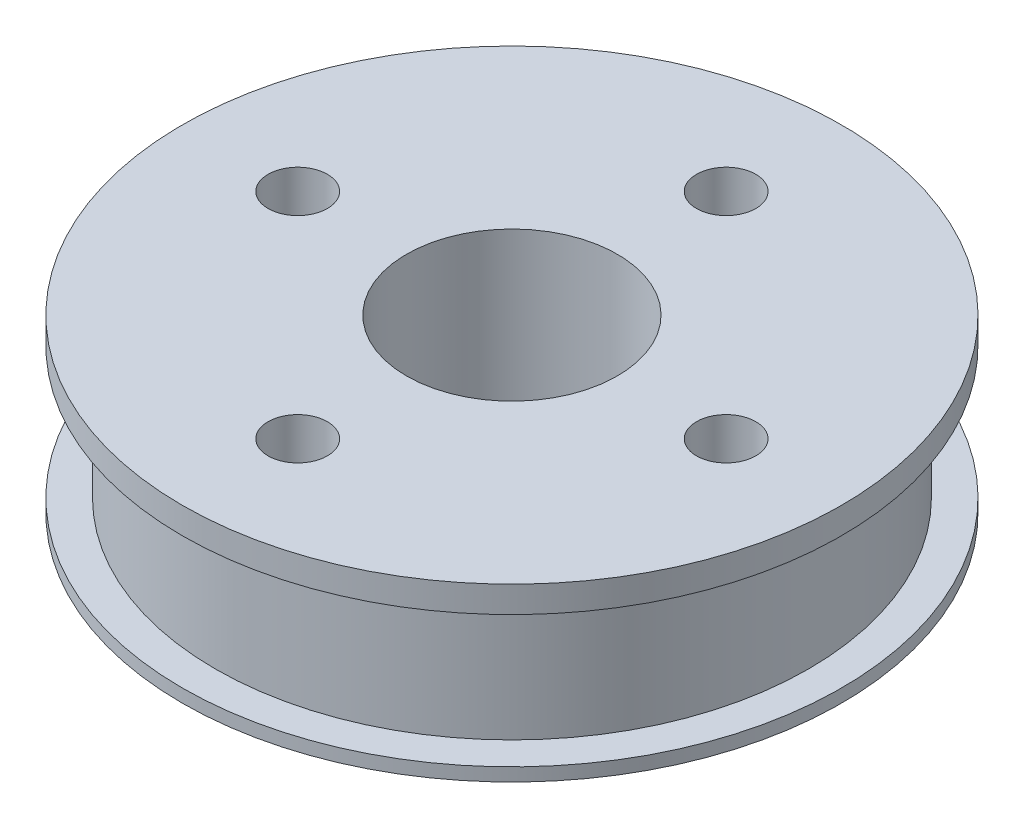
from build123d import *

# Parameters (mm, degrees)
ESCAREADO_PARA_PARAFUSO_COM_CABE_A_ESCAR_D           = 4.5
ESCAREADO_PARA_PARAFUSO_COM_CABE_A_ESCAR_DEPTH       = 30
ESCAREADO_PARA_PARAFUSO_COM_CABE_A_ESCAR_CSINK_D     = 9.4
ESCAREADO_PARA_PARAFUSO_COM_CABE_A_ESCAR_CSINK_ANGLE = 90
ESCAREADO_PARA_PARAFUSO_COM_CABE_A_ESCAR_TIP         = 1.351936393


with BuildPart() as part:
    # Sketch1 → Revolve1 (revolve)
    with BuildSketch(Plane(origin=(0, 0, 0), x_dir=(0, 0, -1), z_dir=(1, 0, 0))):
        Polygon((25, 7.798179075), (22.5, 7.798179075), (8, 7.798179075), (8, -3.962100009), (8, -5.201820925), (25, -5.201820925), (25, -4.201820925), (22.5, -4.201820925), (22.5, 5.798179075), (25, 5.798179075), align=None)
    revolve(axis=Axis((0, 5.251496666, 0), (0, -1, 0)))

    # Escareado para parafuso com cabeça escareada chata de M41
    with Locations(Plane(origin=(0, -5.201820925, 0), x_dir=(-1, 0, 0), z_dir=(0, -1, 0))):
        with Locations((0, 16.25), (-16.25, 0), (0, -16.25), (16.25, 0)):
            CounterSinkHole(ESCAREADO_PARA_PARAFUSO_COM_CABE_A_ESCAR_D / 2, ESCAREADO_PARA_PARAFUSO_COM_CABE_A_ESCAR_CSINK_D / 2, depth=ESCAREADO_PARA_PARAFUSO_COM_CABE_A_ESCAR_DEPTH, counter_sink_angle=ESCAREADO_PARA_PARAFUSO_COM_CABE_A_ESCAR_CSINK_ANGLE)
            with Locations((0, 0, -(ESCAREADO_PARA_PARAFUSO_COM_CABE_A_ESCAR_DEPTH + ESCAREADO_PARA_PARAFUSO_COM_CABE_A_ESCAR_TIP / 2))):  # 118° drill point
                Cone(0, ESCAREADO_PARA_PARAFUSO_COM_CABE_A_ESCAR_D / 2, ESCAREADO_PARA_PARAFUSO_COM_CABE_A_ESCAR_TIP, mode=Mode.SUBTRACT)


solid = part.part
